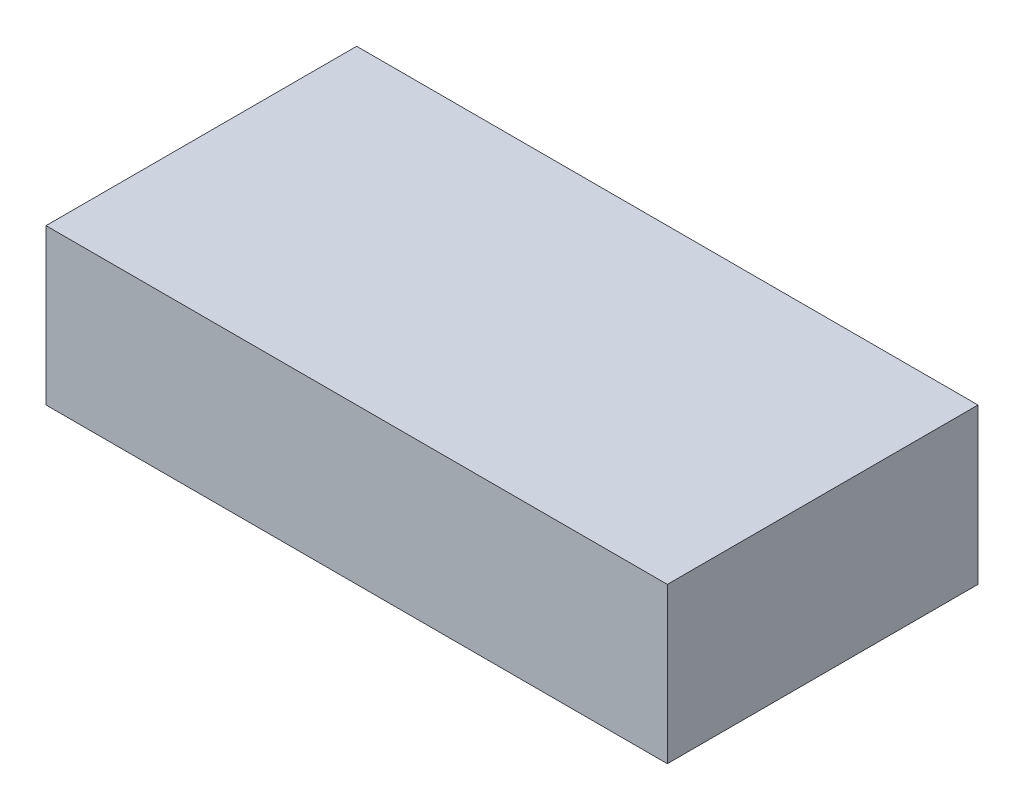
from build123d import *

# Parameters (mm, degrees)
SKETCH1_W           = 40
SKETCH1_H           = 20
BOSS_EXTRUDE1_DEPTH = 10


with BuildPart() as part:
    # Sketch1 → Boss-Extrude1 (new body)
    with BuildSketch(Plane(origin=(0, 0, 0), x_dir=(1, 0, 0), z_dir=(0, 1, 0))):
        with Locations((20, 10)):
            Rectangle(SKETCH1_W, SKETCH1_H)
    extrude(amount=-BOSS_EXTRUDE1_DEPTH)


solid = part.part
